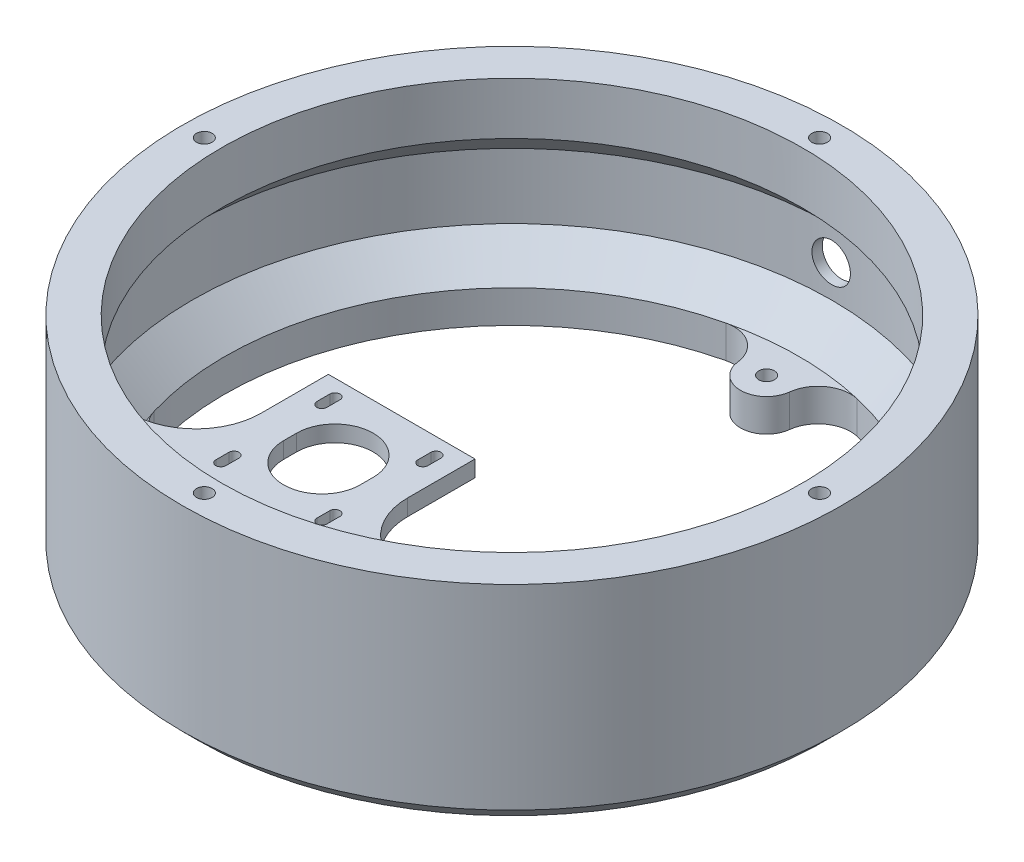
from build123d import *
from build123d.topology import SkipClean

# Parameters (mm, degrees)
SKETCH5_W                = 45
SKETCH5_H                = 45
BOSS_EXTRUDE1_DEPTH      = 5
BOSS_EXTRUDE4_DEPTH      = 10
BOSS_EXTRUDE4_DEPTH_BACK = 55
SKETCH8_R                = 101.15
SKETCH8_R_2              = 89.15
SKETCH8_R_3              = 2.4
SKETCH9_R                = 98.15
CUT_EXTRUDE1_DEPTH       = 50
BOSS_EXTRUDE5_REACH      = 215.657
SKETCH10_W               = 45
SKETCH10_H               = 5
SKETCH11_R               = 101.15
BOSS_EXTRUDE6_DEPTH      = 10
BOSS_EXTRUDE7_START      = -0.241466
SKETCH12_R               = 6.985
BOSS_EXTRUDE7_DEPTH      = 0.241466
CUT_EXTRUDE2_REACH       = 234.769
CUT_EXTRUDE2_END_RADIUS  = 98.15
SKETCH13_R               = 5.9055
FILLET2_R                = 20
CHAMFER2_START           = -15
CHAMFER2_2_OUTLINE_R     = 2.4
CHAMFER2_2_DEPTH         = 10
CHAMFER1_SIZE            = 5
SKETCH16_R               = 88.15
CUT_EXTRUDE4_DEPTH       = 154.256796338
SKETCH17_R               = 2.4
BOSS_EXTRUDE8_DEPTH      = 10
FILLET4_R                = 10
CIRPATTERN1_START        = -55
CIRPATTERN1_OUTLINE_R    = 2.4
CIRPATTERN1_DEPTH        = 10


with BuildPart() as part:
    # Sketch5 → Boss-Extrude1 (new body)
    with BuildSketch(Plane.XZ):
        with Locations((0, 56.33)):
            Rectangle(SKETCH5_W, SKETCH5_H)
        with BuildLine():
            Line((11.75, 58.33), (11.75, 54.33))
            ThreePointArc((11.75, 54.33), (0, 42.58), (-11.75, 54.33))
            Line((-11.75, 54.33), (-11.75, 58.33))
            ThreePointArc((-11.75, 58.33), (0, 70.08), (11.75, 58.33))
        make_face(mode=Mode.SUBTRACT)
        with BuildLine():
            Line((17.05, 42.83), (17.05, 38.83))
            ThreePointArc((17.05, 38.83), (15.5, 37.28), (13.95, 38.83))
            Line((13.95, 38.83), (13.95, 42.83))
            ThreePointArc((13.95, 42.83), (15.5, 44.38), (17.05, 42.83))
        make_face(mode=Mode.SUBTRACT)
        with BuildLine():
            Line((17.05, 73.83), (17.05, 69.83))
            ThreePointArc((17.05, 69.83), (15.5, 68.28), (13.95, 69.83))
            Line((13.95, 69.83), (13.95, 73.83))
            ThreePointArc((13.95, 73.83), (15.5, 75.38), (17.05, 73.83))
        make_face(mode=Mode.SUBTRACT)
        with BuildLine():
            Line((-13.95, 73.83), (-13.95, 69.83))
            ThreePointArc((-13.95, 69.83), (-15.5, 68.28), (-17.05, 69.83))
            Line((-17.05, 69.83), (-17.05, 73.83))
            ThreePointArc((-17.05, 73.83), (-15.5, 75.38), (-13.95, 73.83))
        make_face(mode=Mode.SUBTRACT)
        with BuildLine():
            Line((-13.95, 42.83), (-13.95, 38.83))
            ThreePointArc((-13.95, 38.83), (-15.5, 37.28), (-17.05, 38.83))
            Line((-17.05, 38.83), (-17.05, 42.83))
            ThreePointArc((-17.05, 42.83), (-15.5, 44.38), (-13.95, 42.83))
        make_face(mode=Mode.SUBTRACT)
    extrude(amount=BOSS_EXTRUDE1_DEPTH)


with BuildPart() as body_2:
    # Sketch8 → Boss-Extrude4 (new, two sides: drawn at the far end of the back side and taken through both)
    with BuildSketch(Plane(origin=(0, 0, 0), x_dir=(1, 0, 0), z_dir=(0, 1, 0)).offset(-BOSS_EXTRUDE4_DEPTH_BACK)):
        with Locations(Location((0, 0, 0), (0, 0, 270))):
            Circle(SKETCH8_R)
        with Locations(Location((0, 0, 0), (0, 0, 270))):
            Circle(SKETCH8_R_2, mode=Mode.SUBTRACT)
        with Locations(Location((0, -94.415, 0), (0, 0, 270))):
            Circle(SKETCH8_R_3, mode=Mode.SUBTRACT)
        with Locations(Location((-94.415, 0, 0), (0, 0, 270))):
            Circle(SKETCH8_R_3, mode=Mode.SUBTRACT)
        with Locations(Location((0, 94.415, 0), (0, 0, 270))):
            Circle(SKETCH8_R_3, mode=Mode.SUBTRACT)
        with Locations(Location((94.415, 0, 0), (0, 0, 270))):
            Circle(SKETCH8_R_3, mode=Mode.SUBTRACT)
    extrude(amount=BOSS_EXTRUDE4_DEPTH + BOSS_EXTRUDE4_DEPTH_BACK)

    # Sketch9 → Cut-Extrude1 (cut)
    with BuildSketch(Plane.XZ.offset(55)):
        with Locations(Location((0, 0, 0), (0, 0, 270))):
            Circle(SKETCH9_R)
    extrude(amount=-CUT_EXTRUDE1_DEPTH, mode=Mode.SUBTRACT)

    # Sketch10 → Boss-Extrude5 (add, up to next)
    with BuildSketch(Plane.XY.offset(78.83), mode=Mode.PRIVATE) as boss_extrude5_sk1:
        with Locations((0, -2.5)):
            Rectangle(SKETCH10_W, SKETCH10_H)
    boss_extrude5_tool1 = extrude(boss_extrude5_sk1.sketch, amount=BOSS_EXTRUDE5_REACH, mode=Mode.PRIVATE) - body_2.part

    add(part.part)  # Boss-Extrude5 merges part
    add(boss_extrude5_tool1.solids().sort_by_distance((0, -2.5, 78.83))[0])

    # Sketch11 → Boss-Extrude6 (add)
    with BuildSketch(Plane.XZ.offset(55)):
        with Locations(Location((0, 0, 0), (0, 0, 90))):
            Circle(SKETCH11_R)
    extrude(amount=-BOSS_EXTRUDE6_DEPTH)

    # Sketch12 → Boss-Extrude7 (add)
    with BuildSketch(Plane(origin=(0, 0, -101.15), x_dir=(-1, 0, 0), z_dir=(0, 0, -1)).offset(BOSS_EXTRUDE7_START)):
        with Locations((0, -25)):
            Circle(SKETCH12_R)
    extrude(amount=BOSS_EXTRUDE7_DEPTH)

    # Cut-Extrude2: up to this cylinder (the profile starts outside it)
    cut_extrude2_end = Plane(origin=(0, -25, 0), z_dir=(0, -1, 0)) * Cylinder(CUT_EXTRUDE2_END_RADIUS, 666.838, mode=Mode.PRIVATE)
    # Sketch13 → Cut-Extrude2 (cut, up to the surface)
    with BuildSketch(Plane(origin=(0, 0, -101.15), x_dir=(-1, 0, 0), z_dir=(0, 0, -1)), mode=Mode.PRIVATE) as cut_extrude2_sk1:
        with Locations((0, -25)):
            Circle(SKETCH13_R)
    cut_extrude2_tool1 = extrude(cut_extrude2_sk1.sketch, amount=-CUT_EXTRUDE2_REACH, mode=Mode.PRIVATE) - cut_extrude2_end
    add(cut_extrude2_tool1.solids().sort_by_distance((0, -25, -101.15))[0], mode=Mode.SUBTRACT)

    # Fillet2
    fillet2_edges = [body_2.edges().sort_by_distance(p)[0] for p in [
        (22.5, -2.5, 86.263969883),
        (-22.5, -2.5, 86.263969883),
    ]]
    fillet(fillet2_edges, radius=FILLET2_R)

    # Chamfer2: read off the stored shape, not the designer's step
    # Chamfer2 outline → Chamfer2 (revolve)
    with BuildSketch(Plane.XY):
        Polygon((98.15, -5), (88.15, -5), (98.15, -15), align=None)
        Polygon((98.15, -45), (98.15, -35), (88.15, -45), align=None)
    revolve(axis=Axis((0, 0, 0), (0, 1, 0)))

    # Chamfer2 2 outline → Chamfer2 2 (cut)
    with BuildSketch(Plane(origin=(0, 0, 0), x_dir=(1, 0, 0), z_dir=(0, 1, 0)).offset(CHAMFER2_START)):
        with BuildLine():
            ThreePointArc((-54.792118583, -70.324577789), (-51.769115332, -72.270292908), (-48.446618716, -73.643381475))
            ThreePointArc((-48.446618716, -73.643381475), (0, 88.15), (48.446618716, -73.643381475))
            ThreePointArc((48.446618716, -73.643381475), (51.769115332, -72.270292908), (54.792118583, -70.324577789))
            ThreePointArc((54.792118583, -70.324577789), (0, 89.15), (-54.792118583, -70.324577789))
        make_face()
        with Locations((0, 94.415)):
            Circle(CHAMFER2_2_OUTLINE_R)
        with Locations((0, -94.415)):
            Circle(CHAMFER2_2_OUTLINE_R)
        with Locations((-94.415, 0)):
            Circle(CHAMFER2_2_OUTLINE_R)
        with Locations((94.415, 0)):
            Circle(CHAMFER2_2_OUTLINE_R)
    extrude(amount=CHAMFER2_2_DEPTH, mode=Mode.SUBTRACT)

    # Chamfer1
    chamfer1_edges = [body_2.edges().sort_by_distance(p)[0] for p in [
        (0, -55, -101.15),
    ]]
    chamfer(chamfer1_edges, length=CHAMFER1_SIZE)

    # Sketch16 → Cut-Extrude4 (cut, through all)
    with SkipClean():  # the faces are left unmerged after this step: merging them gives an invalid solid
        with BuildSketch(Plane(origin=(0, -45, 0), x_dir=(1, 0, 0), z_dir=(0, 1, 0))):
            with Locations(Location((0, 0, 0), (0, 0, 270))):
                Circle(SKETCH16_R)
        extrude(amount=-CUT_EXTRUDE4_DEPTH, mode=Mode.SUBTRACT)

    # Sketch17 → Boss-Extrude8 (add)
    with SkipClean():  # the faces are left unmerged after this step: merging them gives an invalid solid
        with BuildSketch(Plane(origin=(0, -45, 0), x_dir=(1, 0, 0), z_dir=(0, 1, 0))):
            with BuildLine():
                Line((8, 87.786231836), (8, 78.15))
                ThreePointArc((8, 78.15), (0, 70.15), (-8, 78.15))
                Line((-8, 78.15), (-8, 87.786231836))
                ThreePointArc((-8, 87.786231836), (0, 88.15), (8, 87.786231836))
            make_face()
            with Locations(Location((0, 78.15, 0), (0, 0, 270))):
                Circle(SKETCH17_R, mode=Mode.SUBTRACT)
        extrude(amount=-BOSS_EXTRUDE8_DEPTH)

    # Fillet4
    # the kernel refuses this fillet: 10 mm, written as the material it adds along each edge
    with BuildSketch(Plane(origin=(8, -45, -87.786231836), x_dir=(0.9870900713729507, 0, 0.16016613561219292), z_dir=(0, -1, 0))) as fillet4_piece_1:
        with BuildLine():
            CenterArc((11.628097728, 9.975524326), FILLET4_R, 177.396495795, 96.61303525)
            Line((1.638419792, 10.429765176), (0.639451999, 10.475189261))
            ThreePointArc((0.639451999, 10.475189261), (0.556307944, 9.671994907), (-0.987090071, 0.160166136))
            Line((-0.987090071, 0.160166136), (-0.069922416, -0.997552433))
            ThreePointArc((-0.069922416, -0.997552433), (6.163660942, -1.215753066), (12.3972443, -0.997552433))
            Line((12.3972443, -0.997552433), (12.327321884, 0))
        make_face()
    extrude(amount=10)
    with BuildSketch(Plane(origin=(-8, -45, -87.786231836), x_dir=(-0.9870900713729502, 0, 0.1601661356121951), z_dir=(0, -1, 0))) as fillet4_piece_2:
        with BuildLine():
            CenterArc((11.628097728, -9.975524326), FILLET4_R, 85.990468955, 96.61303525)
            Line((1.638419792, -10.429765176), (0.639451999, -10.475189261))
            ThreePointArc((0.639451999, -10.475189261), (0.556307944, -9.671994907), (-0.987090071, -0.160166136))
            Line((-0.987090071, -0.160166136), (-0.069922416, 0.997552433))
            ThreePointArc((-0.069922416, 0.997552433), (6.163660942, 1.215753066), (12.3972443, 0.997552433))
            Line((12.3972443, 0.997552433), (12.327321884, 0))
        make_face()
    extrude(amount=10)

    # CirPattern1: read off the stored shape, not the designer's step
    # CirPattern1 outline → CirPattern1 (add)
    # profile 1 of 2: a face of its own
    with SkipClean():  # the faces are left unmerged after this step: merging them gives an invalid solid
        with BuildSketch(Plane(origin=(0, 0, 0), x_dir=(1, 0, 0), z_dir=(0, 1, 0)).offset(CIRPATTERN1_START)):
            with BuildLine():
                ThreePointArc((-64.231120901, -60.372059827), (-66.905263617, -52.637728746), (-62.90862525, -45.496454468))
                ThreePointArc((-62.90862525, -45.496454468), (-60.751682075, -35.075), (-70.855397976, -31.73224035))
                ThreePointArc((-70.855397976, -31.73224035), (-79.0382421, -31.622793567), (-84.39929794, -25.4397525))
                ThreePointArc((-84.39929794, -25.4397525), (-76.340139344, -44.075), (-64.231120901, -60.372059827))
            make_face()
            with Locations((-67.679885306, -39.075)):
                Circle(CIRPATTERN1_OUTLINE_R, mode=Mode.SUBTRACT)
        # profile 2 of 2: a face of its own
        with BuildSketch(Plane(origin=(0, 0, 0), x_dir=(1, 0, 0), z_dir=(0, 1, 0)).offset(CIRPATTERN1_START)):
            with BuildLine():
                ThreePointArc((62.90862525, -45.496454468), (66.905263617, -52.637728746), (64.231120901, -60.372059827))
                ThreePointArc((64.231120901, -60.372059827), (76.340139344, -44.075), (84.39929794, -25.4397525))
                ThreePointArc((84.39929794, -25.4397525), (79.0382421, -31.622793567), (70.855397976, -31.73224035))
                ThreePointArc((70.855397976, -31.73224035), (60.751682075, -35.075), (62.90862525, -45.496454468))
            make_face()
            with Locations((67.679885306, -39.075)):
                Circle(CIRPATTERN1_OUTLINE_R, mode=Mode.SUBTRACT)
        extrude(amount=CIRPATTERN1_DEPTH)


solid = body_2.part
